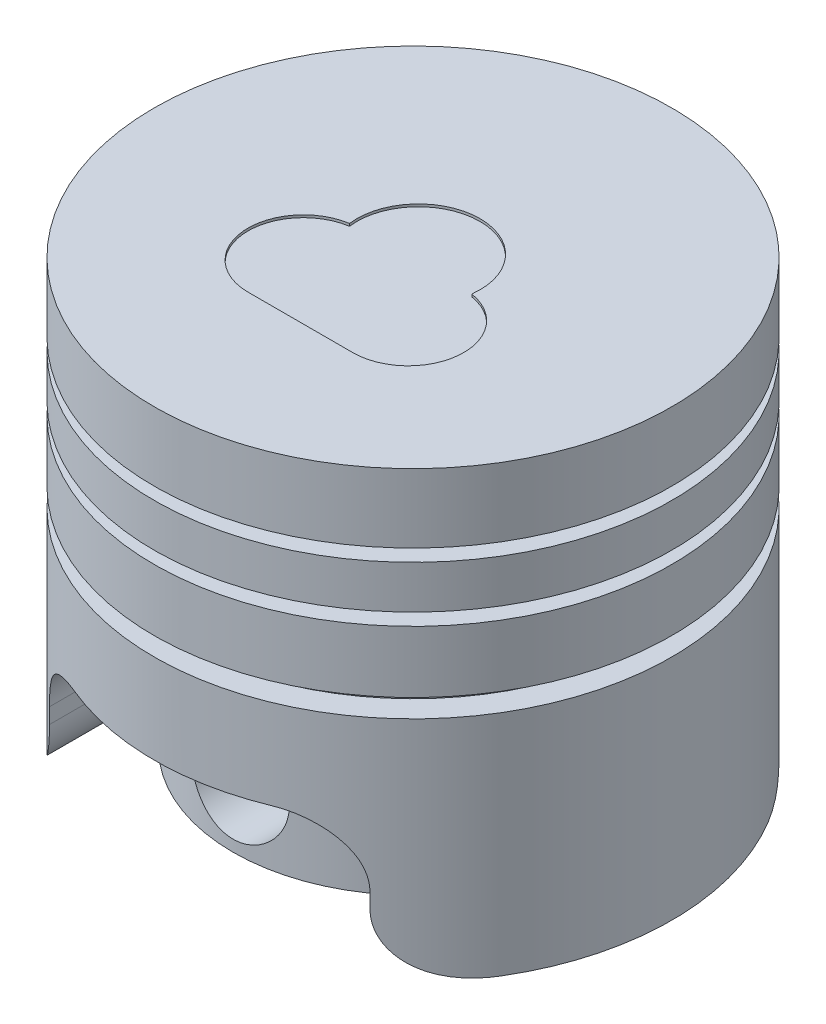
from build123d import *

# Parameters (mm, degrees)
CUT_EXTRUDE1_DEPTH      = 79.943017424
CUT_EXTRUDE1_DEPTH_BACK = 79.943017424
SKETCH2_W               = 52
SKETCH2_H               = 45
FILLET1_R               = 10
FILLET2_R               = 10
BOSS_EXTRUDE1_DEPTH     = 56
CUT_EXTRUDE2_DEPTH      = 88.846457129
CUT_EXTRUDE2_DEPTH_BACK = 88.846457129
SKETCH4_R               = 8
FILLET3_R               = 10
CUT_EXTRUDE3_DEPTH      = 0.4


with BuildPart() as part:
    # Sketch1 → Revolve1 (revolve)
    with BuildSketch(Plane.XY):
        Polygon((0, 20.16), (-42, 20.16), (-42, 9), (-38, 9), (-38, 7), (-42, 7), (-42, 0), (-38, 0), (-38, -2), (-42, -2), (-42, -12), (-38, -12), (-38, -15), (-42, -15), (-42, -52), (-29.2, -52), (-29.2, 7.16), (0, 7.16), align=None)
    revolve(axis=Axis((0, 20.16, 0), (0, -1, 0)))

    # Sketch2 → Cut-Extrude1 (cut, two sides: drawn at the far end of the back side and taken through both)
    with BuildSketch(Plane.XY.offset(-CUT_EXTRUDE1_DEPTH_BACK)):
        with Locations((0, -52)):
            Rectangle(SKETCH2_W, SKETCH2_H)
    extrude(amount=CUT_EXTRUDE1_DEPTH + CUT_EXTRUDE1_DEPTH_BACK, mode=Mode.SUBTRACT)

    # Fillet1
    fillet1_edges = [part.edges().sort_by_distance(p)[0] for p in [
        (26, -29.5, -23.137721593),
        (26, -29.5, 23.137721593),
    ]]
    fillet(fillet1_edges, radius=FILLET1_R)

    # Fillet2
    fillet2_edges = [part.edges().sort_by_distance(p)[0] for p in [
        (-26, -29.5, 23.137721593),
        (-26, -29.5, -23.137721593),
    ]]
    fillet(fillet2_edges, radius=FILLET2_R)

    # Sketch3 → Boss-Extrude1 (add)
    with BuildSketch(Plane.XZ.offset(-7.16)):
        with BuildLine():
            Line((25.052744361, 15), (-25.052744361, 15))
            ThreePointArc((-25.052744361, 15), (0, 29.2), (25.052744361, 15))
        make_face()
        with BuildLine():
            Line((25.052744361, -15), (-25.052744361, -15))
            ThreePointArc((-25.052744361, -15), (0, -29.2), (25.052744361, -15))
        make_face()
    extrude(amount=BOSS_EXTRUDE1_DEPTH)

    # Sketch4 → Cut-Extrude2 (cut, two sides: drawn at the far end of the back side and taken through both)
    with BuildSketch(Plane.XY.offset(-15).offset(-CUT_EXTRUDE2_DEPTH_BACK)):
        with Locations((0, -39)):
            Circle(SKETCH4_R)
    extrude(amount=CUT_EXTRUDE2_DEPTH + CUT_EXTRUDE2_DEPTH_BACK, mode=Mode.SUBTRACT)

    # Fillet3
    fillet3_edges = [part.edges().sort_by_distance(p)[0] for p in [
        (26, -52, 23.137721593),
        (-26, -52, 23.137721593),
    ]]
    fillet(fillet3_edges, radius=FILLET3_R)

    # Sketch5 → Cut-Extrude3 (cut)
    with BuildSketch(Plane(origin=(0, 20.16, 0), x_dir=(1, 0, 0), z_dir=(0, 1, 0))):
        with BuildLine():
            Line((-8.5, -18.271629277), (8.5, -18.271629277))
            ThreePointArc((8.5, -18.271629277), (17.471776469, -9.983827979), (9.919930569, -0.384346386))
            ThreePointArc((9.919930569, -0.384346386), (0, 10.878577802), (-9.919930569, -0.384346386))
            ThreePointArc((-9.919930569, -0.384346386), (-17.471776469, -9.983827979), (-8.5, -18.271629277))
        make_face()
    extrude(amount=-CUT_EXTRUDE3_DEPTH, mode=Mode.SUBTRACT)


solid = part.part
